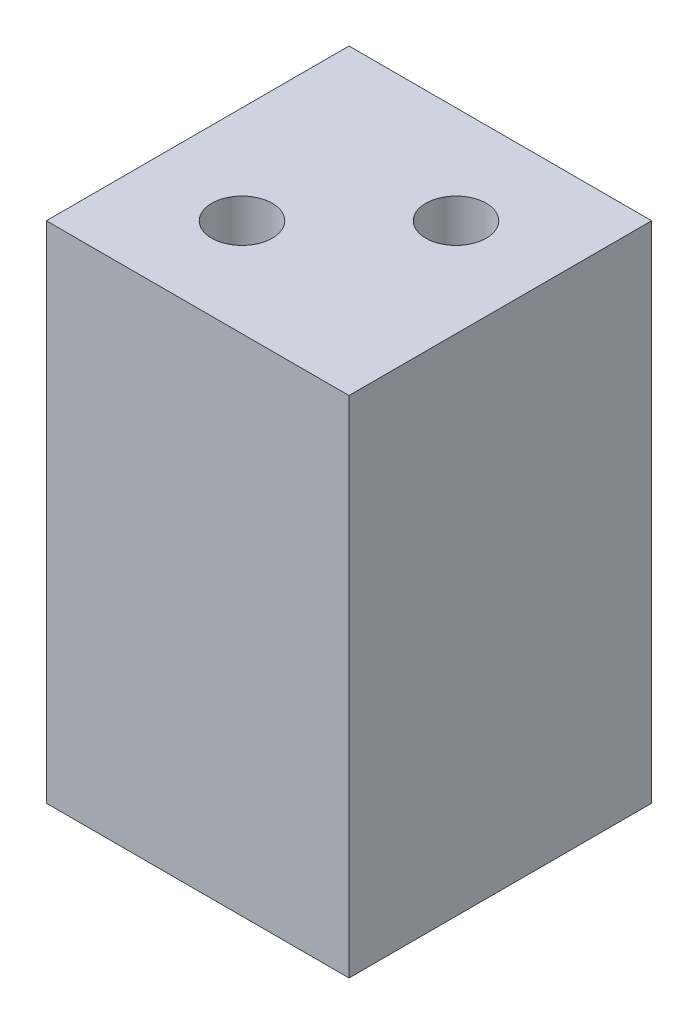
from build123d import *

# Parameters (mm, degrees)
SKETCH1_W           = 30
SKETCH1_H           = 30
SKETCH1_R           = 3
BOSS_EXTRUDE1_DEPTH = 50


with BuildPart() as part:
    # Sketch1 → Boss-Extrude1 (new body)
    with BuildSketch(Plane(origin=(0, 0, 0), x_dir=(1, 0, 0), z_dir=(0, 1, 0))):
        Rectangle(SKETCH1_W, SKETCH1_H)
        with Locations((-5.303300859, -5.303300859)):
            Circle(SKETCH1_R, mode=Mode.SUBTRACT)
        with Locations((5.303300859, 5.303300859)):
            Circle(SKETCH1_R, mode=Mode.SUBTRACT)
    extrude(amount=BOSS_EXTRUDE1_DEPTH)


solid = part.part
